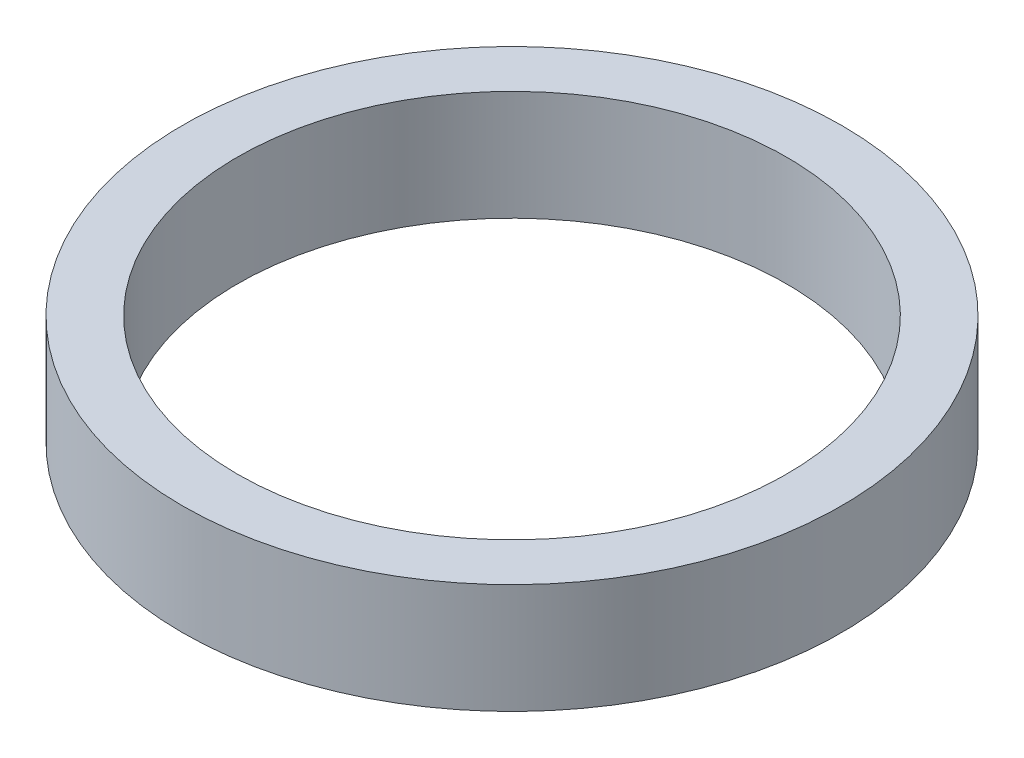
from build123d import *

# Parameters (mm, degrees)
SKETCH1_R           = 60
BOSS_EXTRUDE1_DEPTH = 20
SKETCH2_R           = 50
CUT_EXTRUDE1_DEPTH  = 88.177978871


with BuildPart() as part:
    # Sketch1 → Boss-Extrude1 (new body)
    with BuildSketch(Plane(origin=(0, 0, 0), x_dir=(1, 0, 0), z_dir=(0, 1, 0))):
        Circle(SKETCH1_R)
    extrude(amount=BOSS_EXTRUDE1_DEPTH)

    # Sketch2 → Cut-Extrude1 (cut, through all)
    with BuildSketch(Plane(origin=(0, 0, 0), x_dir=(1, 0, 0), z_dir=(0, 1, 0))):
        Circle(SKETCH2_R)
    extrude(amount=CUT_EXTRUDE1_DEPTH, mode=Mode.SUBTRACT)


solid = part.part
